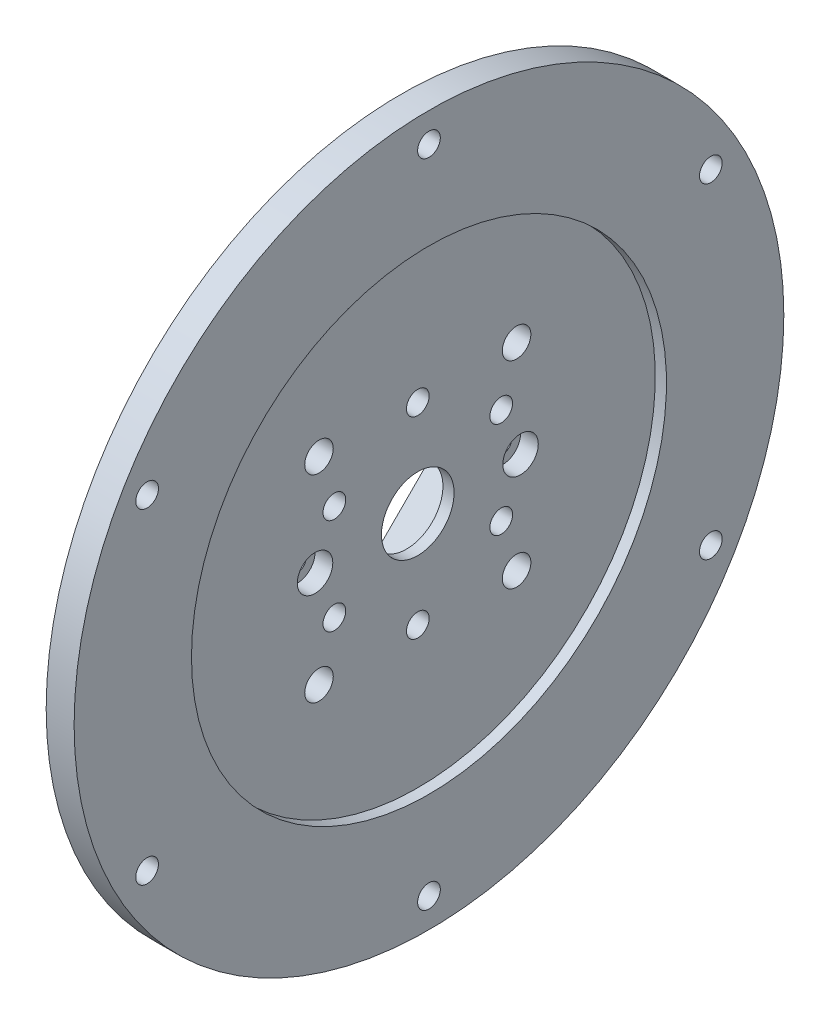
from build123d import *

# Parameters (mm, degrees)
CUT_EXTRUDE1_DEPTH      = 91.850633485
CUT_EXTRUDE1_DEPTH_BACK = 91.850633485
SKETCH4_R               = 2.032
SKETCH5_R               = 1.5875
CUT_EXTRUDE2_DEPTH      = 92.35314773
SKETCH6_R               = 3.175
CUT_EXTRUDE3_DEPTH      = 3.175
BOSS_EXTRUDE1_REACH     = 93.741
FILLET1_R               = 3.175
SKETCH8_R               = 2.5527
CUT_EXTRUDE4_DEPTH      = 92.741144495


with BuildPart() as part:
    # Sketch2 → Revolve1 (revolve)
    with BuildSketch(Plane.XY):
        Polygon((-2.54e-07, 29.999999944), (-1.80000021, 29.999999944), (-11.760000102, 29.999999944), (-13.760000166, 29.999999944), (-13.760000166, 25.4), (-2.000000064, 25.4), (-2.000000064, 11.499999987), (1.000000032, 11.499999987), (1.000000032, 6.499999954), (2.999999842, 6.499999954), (2.999999842, 42.499999963), (4.999999652, 42.499999963), (4.999999652, 63.5), (-2.54e-07, 63.5), align=None)
    revolve(axis=Axis((0, 0, 0), (1, 0, 0)))

    # Sketch4 → Cut-Extrude1 (cut, two sides: drawn at the far end of the back side and taken through both)
    with BuildSketch(Plane(origin=(0, 0, 0), x_dir=(0, 0, -1), z_dir=(1, 0, 0)).offset(-CUT_EXTRUDE1_DEPTH_BACK)):
        with Locations((0, 58.238499982)):
            Circle(SKETCH4_R)
        with Locations((50.436020463, 29.119249991)):
            Circle(SKETCH4_R)
        with Locations((50.436020463, -29.119249991)):
            Circle(SKETCH4_R)
        with Locations((0, -58.238499982)):
            Circle(SKETCH4_R)
        with Locations((-50.436020463, -29.119249991)):
            Circle(SKETCH4_R)
        with Locations((-50.436020463, 29.119249991)):
            Circle(SKETCH4_R)
        with Locations((-14.928978871, 8.61924997)):
            Circle(SKETCH4_R)
        with Locations((0, 17.23849994)):
            Circle(SKETCH4_R)
        with Locations((14.928978871, 8.61924997)):
            Circle(SKETCH4_R)
        with Locations((14.928978871, -8.61924997)):
            Circle(SKETCH4_R)
        with Locations((0, -17.23849994)):
            Circle(SKETCH4_R)
        with Locations((-14.928978871, -8.61924997)):
            Circle(SKETCH4_R)
    extrude(amount=CUT_EXTRUDE1_DEPTH + CUT_EXTRUDE1_DEPTH_BACK, mode=Mode.SUBTRACT)

    # Sketch5 → Cut-Extrude2 (cut, through all)
    with BuildSketch(Plane(origin=(2.999999842, 0, 0), x_dir=(0, 0, -1), z_dir=(1, 0, 0))):
        with Locations((-18.385, 0)):
            Circle(SKETCH5_R)
        with Locations((18.385, 0)):
            Circle(SKETCH5_R)
    extrude(amount=-CUT_EXTRUDE2_DEPTH, mode=Mode.SUBTRACT)

    # Sketch6 → Cut-Extrude3 (cut)
    with BuildSketch(Plane(origin=(2.999999842, 0, 0), x_dir=(0, 0, -1), z_dir=(1, 0, 0))):
        with Locations((-18.385, 0)):
            Circle(SKETCH6_R)
        with Locations((18.385, 0)):
            Circle(SKETCH6_R)
    extrude(amount=-CUT_EXTRUDE3_DEPTH, mode=Mode.SUBTRACT)

    # Sketch7 → Boss-Extrude1 (add, up to next)
    with BuildSketch(Plane.ZY.offset(13.760000166), mode=Mode.PRIVATE) as boss_extrude1_sk1:
        with BuildLine():
            ThreePointArc((25.213720876, 3.070550371), (17.960512242, 17.960512242), (3.070550371, 25.213720876))
            Line((3.070550371, 25.213720876), (25.213720876, 3.070550371))
        make_face()
    boss_extrude1_tool1 = extrude(boss_extrude1_sk1.sketch, amount=-BOSS_EXTRUDE1_REACH, mode=Mode.PRIVATE) - part.part
    # Sketch7 → Boss-Extrude1 (add, up to next)
    with BuildSketch(Plane.ZY.offset(13.760000166), mode=Mode.PRIVATE) as boss_extrude1_sk2:
        with BuildLine():
            Line((-25.213720876, 3.070550371), (-3.070550371, 25.213720876))
            ThreePointArc((-3.070550371, 25.213720876), (-17.960512242, 17.960512242), (-25.213720876, 3.070550371))
        make_face()
    boss_extrude1_tool2 = extrude(boss_extrude1_sk2.sketch, amount=-BOSS_EXTRUDE1_REACH, mode=Mode.PRIVATE) - part.part
    # Sketch7 → Boss-Extrude1 (add, up to next)
    with BuildSketch(Plane.ZY.offset(13.760000166), mode=Mode.PRIVATE) as boss_extrude1_sk3:
        with BuildLine():
            ThreePointArc((3.070550371, -25.213720876), (17.960512242, -17.960512242), (25.213720876, -3.070550371))
            Line((25.213720876, -3.070550371), (3.070550371, -25.213720876))
        make_face()
    boss_extrude1_tool3 = extrude(boss_extrude1_sk3.sketch, amount=-BOSS_EXTRUDE1_REACH, mode=Mode.PRIVATE) - part.part
    # Sketch7 → Boss-Extrude1 (add, up to next)
    with BuildSketch(Plane.ZY.offset(13.760000166), mode=Mode.PRIVATE) as boss_extrude1_sk4:
        with BuildLine():
            Line((-3.070550371, -25.213720876), (-25.213720876, -3.070550371))
            ThreePointArc((-25.213720876, -3.070550371), (-17.960512242, -17.960512242), (-3.070550371, -25.213720876))
        make_face()
    boss_extrude1_tool4 = extrude(boss_extrude1_sk4.sketch, amount=-BOSS_EXTRUDE1_REACH, mode=Mode.PRIVATE) - part.part
    add(boss_extrude1_tool1.solids().sort_by_distance((-13.76, 15.684318, 15.684318))[0])
    add(boss_extrude1_tool2.solids().sort_by_distance((-13.76, 15.684318, -15.684318))[0])
    add(boss_extrude1_tool3.solids().sort_by_distance((-13.76, -15.684318, 15.684318))[0])
    add(boss_extrude1_tool4.solids().sort_by_distance((-13.76, -15.684318, -15.684318))[0])

    # Fillet1
    fillet1_edges = [part.edges().sort_by_distance(p)[0] for p in [
        (-7.880000115, -25.213720876, -3.070550371),
        (-7.880000115, -25.213720876, 3.070550371),
        (-7.880000115, -3.070550371, 25.213720876),
        (-7.880000115, 3.070550371, 25.213720876),
        (-7.880000115, -3.070550371, -25.213720876),
        (-7.880000115, 3.070550371, -25.213720876),
        (-7.880000115, 25.213720876, 3.070550371),
        (-7.880000115, 25.213720876, -3.070550371),
    ]]
    fillet(fillet1_edges, radius=FILLET1_R)

    # Sketch8 → Cut-Extrude4 (cut, through all)
    with BuildSketch(Plane.ZY.offset(13.760000166)):
        with Locations((17.67766951, 17.67766951)):
            Circle(SKETCH8_R)
        with Locations((17.67766951, -17.67766951)):
            Circle(SKETCH8_R)
        with Locations((-17.67766951, -17.67766951)):
            Circle(SKETCH8_R)
        with Locations((-17.67766951, 17.67766951)):
            Circle(SKETCH8_R)
    extrude(amount=-CUT_EXTRUDE4_DEPTH, mode=Mode.SUBTRACT)


solid = part.part
